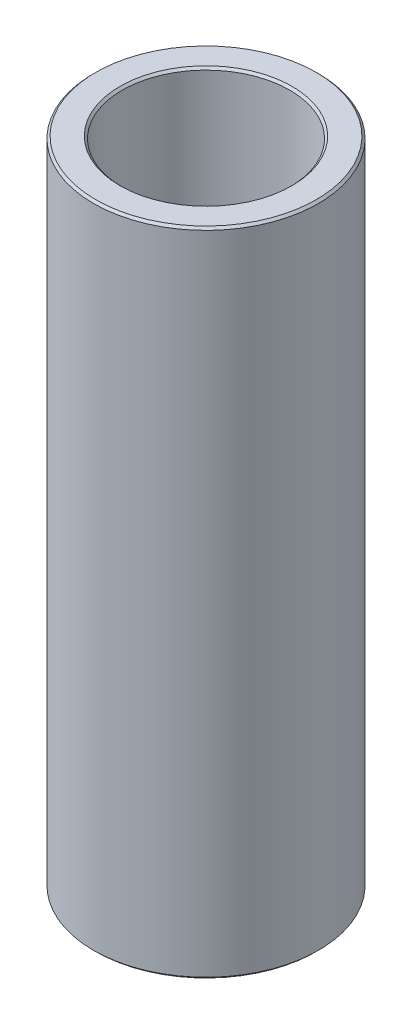
from build123d import *

# Parameters (mm, degrees)
SKETCH1_R           = 42.5
BOSS_EXTRUDE1_DEPTH = 246.052624087
SKETCH2_R           = 31.682829473
CUT_EXTRUDE1_DEPTH  = 254.28717658
CHAMFER1_SIZE       = 0.83254307


with BuildPart() as part:
    # Sketch1 → Boss-Extrude1 (new body)
    with BuildSketch(Plane(origin=(0, 0, 0), x_dir=(1, 0, 0), z_dir=(0, 1, 0))):
        Circle(SKETCH1_R)
    extrude(amount=BOSS_EXTRUDE1_DEPTH)

    # Sketch2 → Cut-Extrude1 (cut, through all)
    with BuildSketch(Plane(origin=(0, 0, 0), x_dir=(1, 0, 0), z_dir=(0, 1, 0))):
        Circle(SKETCH2_R)
    extrude(amount=CUT_EXTRUDE1_DEPTH, mode=Mode.SUBTRACT)

    # Chamfer1
    chamfer1_edges = [part.edges().sort_by_distance(p)[0] for p in [
        (-31.682829473, 246.052624087, 0),
        (-31.682829473, 0, 0),
        (-42.5, 0, 0),
        (-42.5, 246.052624087, 0),
    ]]
    chamfer(chamfer1_edges, length=CHAMFER1_SIZE)


solid = part.part
